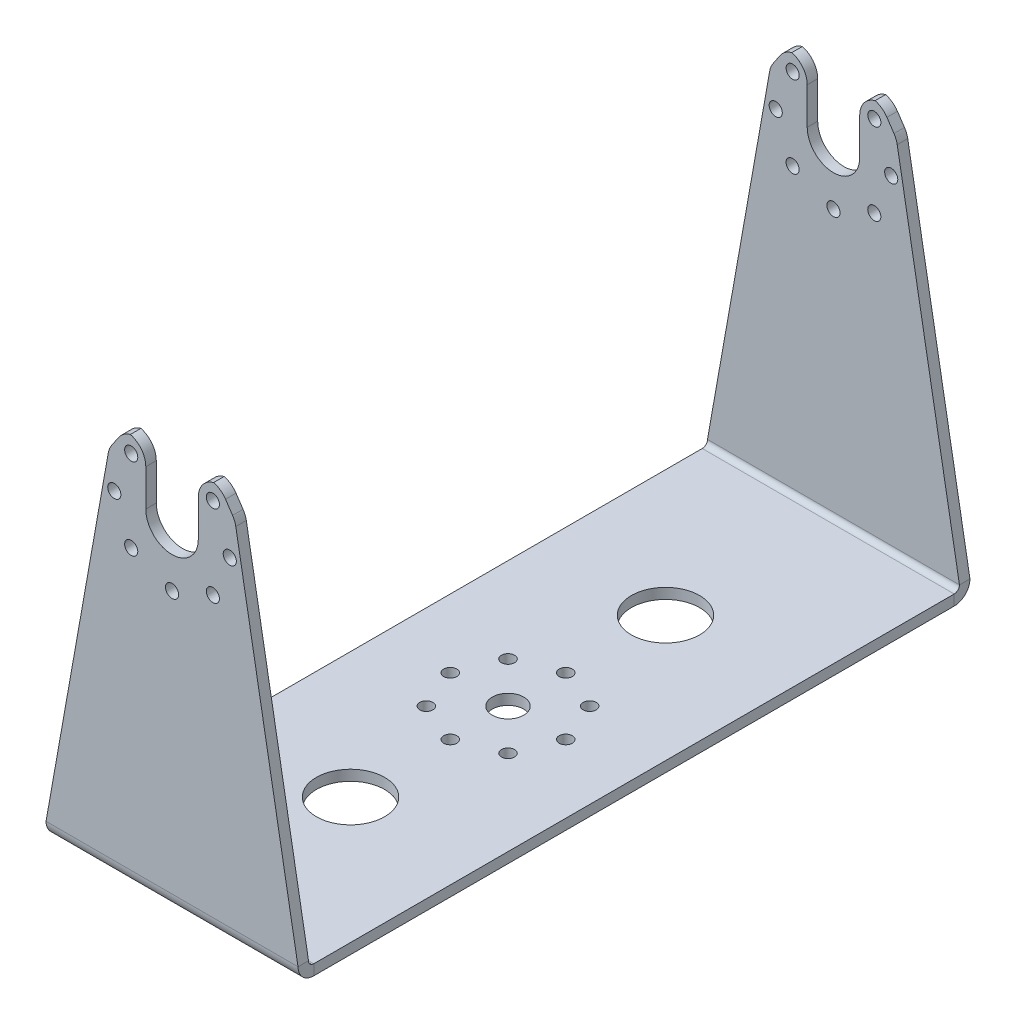
from build123d import *

# Parameters (mm, degrees)
ESBO_O1_W                        = 48
ESBO_O1_H                        = 124
FLANGE_BASE1_DEPTH               = 2
ARESTA_FLANGE1_STRIP_W           = 10
ARESTA_FLANGE1_STRIP_H           = 2
ARESTA_FLANGE1_STRIP_CUT_DEPTH   = 48
ARESTA_FLANGE1_STRIP_2_W         = 10
ARESTA_FLANGE1_STRIP_2_H         = 2
ARESTA_FLANGE1_STRIP_CUT_2_DEPTH = 48
ARESTA_FLANGE1_DEPTH             = 48
ARESTA_FLANGE1_BEND_DEPTH        = 48
CORTE_EXTRUS_O1_REACH            = 151.295
ESBO_O14_R                       = 1.25
ESBO_O15_R                       = 6.5
CORTE_EXTRUS_O2_DEPTH            = 2
FILETE1_R                        = 4
ESBO_O16_R                       = 3
ESBO_O16_R_2                     = 1.25
CORTE_EXTRUS_O3_DEPTH            = 2


# Sheet-metal steps are written as plain solids
with BuildPart() as part:
    # Esboço1 → Flange-base1 (new body)
    with BuildSketch(Plane(origin=(0, 0, 0), x_dir=(1, 0, 0), z_dir=(0, 1, 0))):
        Rectangle(ESBO_O1_W, ESBO_O1_H)
    extrude(amount=-FLANGE_BASE1_DEPTH)

    # Aresta-Flange1 strip (across the edge) → Aresta-Flange1 strip cut (cut)
    with BuildSketch(Plane(origin=(-24, 0, 62), x_dir=(0, 0, -1), z_dir=(1, 0, 0))):
        with Locations((-4, -1)):
            Rectangle(ARESTA_FLANGE1_STRIP_W, ARESTA_FLANGE1_STRIP_H)
    extrude(amount=ARESTA_FLANGE1_STRIP_CUT_DEPTH, mode=Mode.SUBTRACT)

    # Aresta-Flange1 strip 2 (across the edge) → Aresta-Flange1 strip cut 2 (cut)
    with BuildSketch(Plane(origin=(24, 0, -62), x_dir=(0, 0, 1), z_dir=(-1, 0, 0))):
        with Locations((-4, -1)):
            Rectangle(ARESTA_FLANGE1_STRIP_2_W, ARESTA_FLANGE1_STRIP_2_H)
    extrude(amount=ARESTA_FLANGE1_STRIP_CUT_2_DEPTH, mode=Mode.SUBTRACT)

    # Aresta-Flange1 section (across the edge) → Aresta-Flange1 (add)
    with BuildSketch(Plane(origin=(-24, 0, 62), x_dir=(0, 0, -1), z_dir=(1, 0, 0))):
        with BuildLine():
            Line((-2, 1), (-2, 73))
            Line((-2, 73), (0, 73))
            Line((0, 73), (0, 1))
            ThreePointArc((0, 1), (0.292893219, 0.292893219), (1, 0))
            Line((1, 0), (1, -2))
            ThreePointArc((1, -2), (-1.121320344, -1.121320344), (-2, 1))
        make_face()
    extrude(amount=ARESTA_FLANGE1_DEPTH)

    # Aresta-Flange1 section 2 (across the edge) → Aresta-Flange1 bend (add)
    with BuildSketch(Plane(origin=(24, 0, -62), x_dir=(0, 0, 1), z_dir=(-1, 0, 0))):
        with BuildLine():
            Line((-2, 1), (-2, 73))
            Line((-2, 73), (0, 73))
            Line((0, 73), (0, 1))
            ThreePointArc((0, 1), (0.292893219, 0.292893219), (1, 0))
            Line((1, 0), (1, -2))
            ThreePointArc((1, -2), (-1.121320344, -1.121320344), (-2, 1))
        make_face()
    extrude(amount=ARESTA_FLANGE1_BEND_DEPTH)

    # Corte-extrusão1: up to this face of the body (flat: up to its plane)
    corte_extrus_o1_end = Plane(part.part.faces().sort_by_distance((0, 37, -64))[0])
    # Esboço14 → Corte-extrusão1 (cut, up to the picked face)
    with BuildSketch(Plane.XY.offset(64), mode=Mode.PRIVATE) as corte_extrus_o1_sk1:
        with Locations(Location((-11, 62, 0), (0, 0, 180))):
            Circle(ESBO_O14_R)
    corte_extrus_o1_tool1 = split(extrude(corte_extrus_o1_sk1.sketch, amount=-CORTE_EXTRUS_O1_REACH, mode=Mode.PRIVATE), bisect_by=corte_extrus_o1_end, keep=Keep.BOTH, mode=Mode.PRIVATE)
    # Esboço14 → Corte-extrusão1 (cut, up to the picked face)
    with BuildSketch(Plane.XY.offset(64), mode=Mode.PRIVATE) as corte_extrus_o1_sk2:
        with Locations(Location((-7.778174593, 69.778174593, 0), (0, 0, 270))):
            Circle(ESBO_O14_R)
    corte_extrus_o1_tool2 = split(extrude(corte_extrus_o1_sk2.sketch, amount=-CORTE_EXTRUS_O1_REACH, mode=Mode.PRIVATE), bisect_by=corte_extrus_o1_end, keep=Keep.BOTH, mode=Mode.PRIVATE)
    # Esboço14 → Corte-extrusão1 (cut, up to the picked face)
    with BuildSketch(Plane.XY.offset(64), mode=Mode.PRIVATE) as corte_extrus_o1_sk3:
        with Locations(Location((7.778174593, 69.778174593, 0), (0, 0, 270))):
            Circle(ESBO_O14_R)
    corte_extrus_o1_tool3 = split(extrude(corte_extrus_o1_sk3.sketch, amount=-CORTE_EXTRUS_O1_REACH, mode=Mode.PRIVATE), bisect_by=corte_extrus_o1_end, keep=Keep.BOTH, mode=Mode.PRIVATE)
    # Esboço14 → Corte-extrusão1 (cut, up to the picked face)
    with BuildSketch(Plane.XY.offset(64), mode=Mode.PRIVATE) as corte_extrus_o1_sk4:
        with Locations(Location((11, 62, 0), (0, 0, 270))):
            Circle(ESBO_O14_R)
    corte_extrus_o1_tool4 = split(extrude(corte_extrus_o1_sk4.sketch, amount=-CORTE_EXTRUS_O1_REACH, mode=Mode.PRIVATE), bisect_by=corte_extrus_o1_end, keep=Keep.BOTH, mode=Mode.PRIVATE)
    # Esboço14 → Corte-extrusão1 (cut, up to the picked face)
    with BuildSketch(Plane.XY.offset(64), mode=Mode.PRIVATE) as corte_extrus_o1_sk5:
        with Locations(Location((7.778174593, 54.221825407, 0), (0, 0, 270))):
            Circle(ESBO_O14_R)
    corte_extrus_o1_tool5 = split(extrude(corte_extrus_o1_sk5.sketch, amount=-CORTE_EXTRUS_O1_REACH, mode=Mode.PRIVATE), bisect_by=corte_extrus_o1_end, keep=Keep.BOTH, mode=Mode.PRIVATE)
    # Esboço14 → Corte-extrusão1 (cut, up to the picked face)
    with BuildSketch(Plane.XY.offset(64), mode=Mode.PRIVATE) as corte_extrus_o1_sk6:
        with Locations(Location((0, 51, 0), (0, 0, 270))):
            Circle(ESBO_O14_R)
    corte_extrus_o1_tool6 = split(extrude(corte_extrus_o1_sk6.sketch, amount=-CORTE_EXTRUS_O1_REACH, mode=Mode.PRIVATE), bisect_by=corte_extrus_o1_end, keep=Keep.BOTH, mode=Mode.PRIVATE)
    # Esboço14 → Corte-extrusão1 (cut, up to the picked face)
    with BuildSketch(Plane.XY.offset(64), mode=Mode.PRIVATE) as corte_extrus_o1_sk7:
        with Locations(Location((-7.778174593, 54.221825407, 0), (0, 0, 270))):
            Circle(ESBO_O14_R)
    corte_extrus_o1_tool7 = split(extrude(corte_extrus_o1_sk7.sketch, amount=-CORTE_EXTRUS_O1_REACH, mode=Mode.PRIVATE), bisect_by=corte_extrus_o1_end, keep=Keep.BOTH, mode=Mode.PRIVATE)
    # Esboço14 → Corte-extrusão1 (cut, up to the picked face)
    with BuildSketch(Plane.XY.offset(64), mode=Mode.PRIVATE) as corte_extrus_o1_sk8:
        with BuildLine():
            Line((-5, 62), (-5, 73))
            Line((-5, 73), (5, 73))
            Line((5, 73), (5, 62))
            ThreePointArc((5, 62), (0, 57), (-5, 62))
        make_face()
    corte_extrus_o1_tool8 = split(extrude(corte_extrus_o1_sk8.sketch, amount=-CORTE_EXTRUS_O1_REACH, mode=Mode.PRIVATE), bisect_by=corte_extrus_o1_end, keep=Keep.BOTH, mode=Mode.PRIVATE)
    # Esboço14 → Corte-extrusão1 (cut, up to the picked face)
    with BuildSketch(Plane.XY.offset(64), mode=Mode.PRIVATE) as corte_extrus_o1_sk9:
        Polygon((-24, 1), (-12, 68.528174593), (-9, 73), (-24, 73), align=None)
    corte_extrus_o1_tool9 = split(extrude(corte_extrus_o1_sk9.sketch, amount=-CORTE_EXTRUS_O1_REACH, mode=Mode.PRIVATE), bisect_by=corte_extrus_o1_end, keep=Keep.BOTH, mode=Mode.PRIVATE)
    # Esboço14 → Corte-extrusão1 (cut, up to the picked face)
    with BuildSketch(Plane.XY.offset(64), mode=Mode.PRIVATE) as corte_extrus_o1_sk10:
        Polygon((24, 73), (9, 73), (12, 68.528174593), (24, 1), align=None)
    corte_extrus_o1_tool10 = split(extrude(corte_extrus_o1_sk10.sketch, amount=-CORTE_EXTRUS_O1_REACH, mode=Mode.PRIVATE), bisect_by=corte_extrus_o1_end, keep=Keep.BOTH, mode=Mode.PRIVATE)
    add(corte_extrus_o1_tool1.solids().sort_by(Axis((-11, 62, 64), (0, 0, -1)))[0], mode=Mode.SUBTRACT)
    add(corte_extrus_o1_tool2.solids().sort_by(Axis((-7.778175, 69.778175, 64), (0, 0, -1)))[0], mode=Mode.SUBTRACT)
    add(corte_extrus_o1_tool3.solids().sort_by(Axis((7.778175, 69.778175, 64), (0, 0, -1)))[0], mode=Mode.SUBTRACT)
    add(corte_extrus_o1_tool4.solids().sort_by(Axis((11, 62, 64), (0, 0, -1)))[0], mode=Mode.SUBTRACT)
    add(corte_extrus_o1_tool5.solids().sort_by(Axis((7.778175, 54.221825, 64), (0, 0, -1)))[0], mode=Mode.SUBTRACT)
    add(corte_extrus_o1_tool6.solids().sort_by(Axis((0, 51, 64), (0, 0, -1)))[0], mode=Mode.SUBTRACT)
    add(corte_extrus_o1_tool7.solids().sort_by(Axis((-7.778175, 54.221825, 64), (0, 0, -1)))[0], mode=Mode.SUBTRACT)
    add(corte_extrus_o1_tool8.solids().sort_by(Axis((0, 65.494788, 64), (0, 0, -1)))[0], mode=Mode.SUBTRACT)
    add(corte_extrus_o1_tool9.solids().sort_by(Axis((-19.639786, 49.238418, 64), (0, 0, -1)))[0], mode=Mode.SUBTRACT)
    add(corte_extrus_o1_tool10.solids().sort_by(Axis((19.639786, 49.238418, 64), (0, 0, -1)))[0], mode=Mode.SUBTRACT)

    # Esboço15 → Corte-extrusão2 (cut)
    with BuildSketch(Plane(origin=(0, 0, 0), x_dir=(1, 0, 0), z_dir=(0, 1, 0))):
        with Locations(Location((0, -30, 0), (0, 0, 270))):
            Circle(ESBO_O15_R)
        with Locations(Location((0, 30, 0), (0, 0, 270))):
            Circle(ESBO_O15_R)
    extrude(amount=-CORTE_EXTRUS_O2_DEPTH, mode=Mode.SUBTRACT)

    # Filete1
    # the kernel refuses this fillet: 4 mm, written as the material it takes off along each edge
    with BuildSketch(Plane(origin=(-12, 68.528174593, -59.894503429), x_dir=(-0.17496254204261552, -0.9845750905248344, 0), z_dir=(0, 0, -1)), Plane(origin=(-12, 68.528174593, 66.105496571), x_dir=(-0.17496254204261552, -0.9845750905248344, 0), z_dir=(0, 0, -1))) as filete1_piece_1:
        with BuildLine():
            CenterArc((FILETE1_R * 0.210549657125, -FILETE1_R), FILETE1_R, 90, 23.779877271)
            Line((-FILETE1_R * 0.192674273309, -FILETE1_R * 0.0848986602977), (0, 0))
            Line((0, 0), (FILETE1_R * 0.210549657125, 0))
        make_face()
    extrude(amount=6.210993143, mode=Mode.SUBTRACT)
    with BuildSketch(Plane(origin=(-9, 73, -56.666815681), x_dir=(1, 0, 0), z_dir=(0, 0, -1)), Plane(origin=(9, 73, -56.666815681), x_dir=(0.5571126944302854, -0.8304369004955329, 0), z_dir=(0, 0, -1)), Plane(origin=(9, 73, 69.333184319), x_dir=(0.5571126944302854, -0.8304369004955329, 0), z_dir=(0, 0, -1))) as filete1_piece_2:
        with BuildLine():
            CenterArc((FILETE1_R * 0.533318431907, FILETE1_R), FILETE1_R, 213.856355566, 56.143644434)
            Line((-FILETE1_R * 0.297118468589, FILETE1_R * 0.44288730557), (0, 0))
            Line((0, 0), (FILETE1_R * 0.533318431907, 0))
        make_face()
    extrude(amount=12.666368638, mode=Mode.SUBTRACT)
    with BuildSketch(Plane(origin=(-5, 73, -52), x_dir=(0, -1, 0), z_dir=(0, 0, -1)), Plane(origin=(5, 73, -52), x_dir=(1, 0, 0), z_dir=(0, 0, -1)), Plane(origin=(5, 73, 74), x_dir=(1, 0, 0), z_dir=(0, 0, -1)), Plane(origin=(-5, 73, 74), x_dir=(0, -1, 0), z_dir=(0, 0, -1))) as filete1_piece_3:
        with BuildLine():
            CenterArc((FILETE1_R, FILETE1_R), FILETE1_R, 180, 90)
            Line((0, FILETE1_R), (0, 0))
            Line((0, 0), (FILETE1_R, 0))
        make_face()
    extrude(amount=22, mode=Mode.SUBTRACT)
    with BuildSketch(Plane(origin=(12, 68.528174593, -59.894503429), x_dir=(0.17496254204261671, -0.9845750905248343, 0), z_dir=(0, 0, -1)), Plane(origin=(12, 68.528174593, 66.105496571), x_dir=(0.17496254204261671, -0.9845750905248343, 0), z_dir=(0, 0, -1))) as filete1_piece_4:
        with BuildLine():
            CenterArc((FILETE1_R * 0.210549657125, FILETE1_R), FILETE1_R, 246.220122729, 23.779877271)
            Line((-FILETE1_R * 0.192674273309, FILETE1_R * 0.0848986602977), (0, 0))
            Line((0, 0), (FILETE1_R * 0.210549657125, 0))
        make_face()
    extrude(amount=6.210993143, mode=Mode.SUBTRACT)
    with BuildSketch(Plane(origin=(-9, 73, 69.333184319), x_dir=(-0.5571126944302854, -0.8304369004955329, 0), z_dir=(0, 0, -1))) as filete1_piece_5:
        with BuildLine():
            CenterArc((FILETE1_R * 0.533318431907, -FILETE1_R), FILETE1_R, 90, 56.143644434)
            Line((-FILETE1_R * 0.297118468589, -FILETE1_R * 0.44288730557), (0, 0))
            Line((0, 0), (FILETE1_R * 0.533318431907, 0))
        make_face()
    extrude(amount=12.666368638, mode=Mode.SUBTRACT)

    # Esboço16 → Corte-extrusão3 (cut)
    with BuildSketch(Plane.XZ.offset(2)):
        with Locations(Location((0, 0, 0), (0, 0, 270))):
            Circle(ESBO_O16_R)
        with Locations(Location((0, 11, 0), (0, 0, 270))):
            Circle(ESBO_O16_R_2)
        with Locations(Location((7.778174593, 7.778174593, 0), (0, 0, 270))):
            Circle(ESBO_O16_R_2)
        with Locations(Location((11, 0, 0), (0, 0, 270))):
            Circle(ESBO_O16_R_2)
        with Locations(Location((7.778174593, -7.778174593, 0), (0, 0, 270))):
            Circle(ESBO_O16_R_2)
        with Locations(Location((0, -11, 0), (0, 0, 270))):
            Circle(ESBO_O16_R_2)
        with Locations(Location((-7.778174593, -7.778174593, 0), (0, 0, 270))):
            Circle(ESBO_O16_R_2)
        with Locations(Location((-11, 0, 0), (0, 0, 270))):
            Circle(ESBO_O16_R_2)
        with Locations(Location((-7.778174593, 7.778174593, 0), (0, 0, 270))):
            Circle(ESBO_O16_R_2)
    extrude(amount=-CORTE_EXTRUS_O3_DEPTH, mode=Mode.SUBTRACT)


solid = part.part
